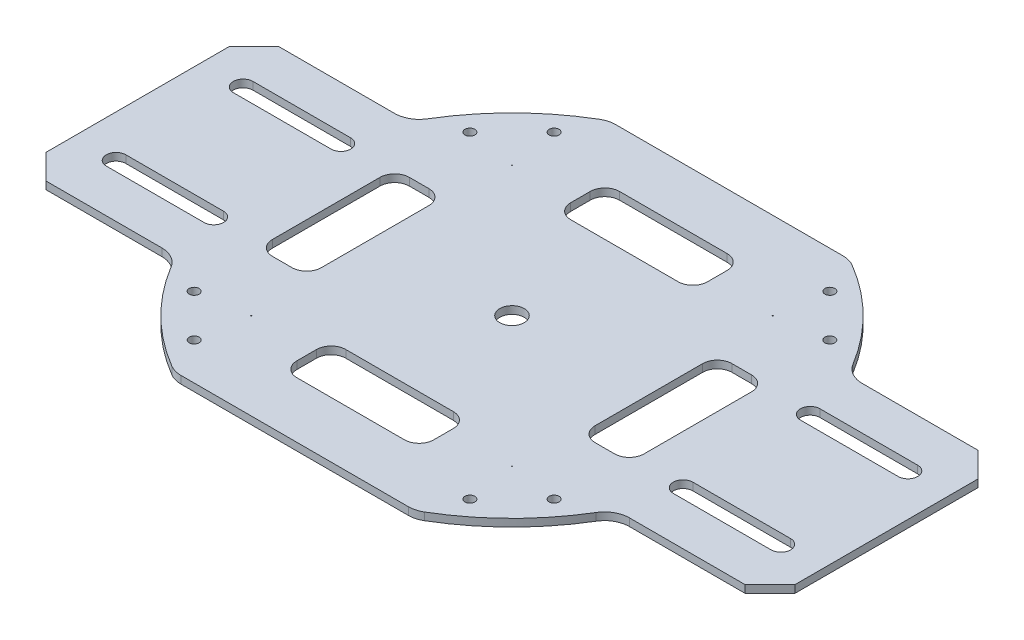
from build123d import *

# Parameters (mm, degrees)
SKETCH1_R           = 2.5
SKETCH1_R_2         = 1.016
SKETCH1_R_3         = 0.080960088
BOSS_EXTRUDE1_DEPTH = 1.55
CUT_EXTRUDE1_DEPTH  = 89.573620564
CUT_EXTRUDE2_DEPTH  = 89.573620564


with BuildPart() as part:
    # Sketch1 → Boss-Extrude1 (new body)
    with BuildSketch(Plane(origin=(0, 0, 0), x_dir=(1, 0, 0), z_dir=(0, 1, 0))):
        with BuildLine():
            Line((-23.244816627, 44.45), (23.244816627, 44.45))
            ThreePointArc((23.244816627, 44.45), (24.583514169, 44.270437622), (25.827574029, 43.744444444))
            ThreePointArc((25.827574029, 43.744444444), (35.740062311, 36.101079569), (43.482663438, 26.265909091))
            ThreePointArc((43.482663438, 26.265909091), (45.334600658, 24.468164919), (47.830929781, 23.8125))
            Line((47.830929781, 23.8125), (71.516875, 23.8125))
            Line((71.516875, 23.8125), (76.596875, 18.7325))
            Line((76.596875, 18.7325), (76.596875, -18.7325))
            Line((76.596875, -18.7325), (71.516875, -23.8125))
            Line((71.516875, -23.8125), (47.830929781, -23.8125))
            ThreePointArc((47.830929781, -23.8125), (45.334600658, -24.468164919), (43.482663438, -26.265909091))
            ThreePointArc((43.482663438, -26.265909091), (35.740062311, -36.101079569), (25.827574029, -43.744444444))
            ThreePointArc((25.827574029, -43.744444444), (24.583514169, -44.270437622), (23.244816627, -44.45))
            Line((23.244816627, -44.45), (-23.244816627, -44.45))
            ThreePointArc((-23.244816627, -44.45), (-24.583514169, -44.270437622), (-25.827574029, -43.744444444))
            ThreePointArc((-25.827574029, -43.744444444), (-35.740062311, -36.101079569), (-43.482663438, -26.265909091))
            ThreePointArc((-43.482663438, -26.265909091), (-45.334600658, -24.468164919), (-47.830929781, -23.8125))
            Line((-47.830929781, -23.8125), (-71.516875, -23.8125))
            Line((-71.516875, -23.8125), (-76.596875, -18.7325))
            Line((-76.596875, -18.7325), (-76.596875, 18.7325))
            Line((-76.596875, 18.7325), (-71.516875, 23.8125))
            Line((-71.516875, 23.8125), (-47.830929781, 23.8125))
            ThreePointArc((-47.830929781, 23.8125), (-45.334600658, 24.468164919), (-43.482663438, 26.265909091))
            ThreePointArc((-43.482663438, 26.265909091), (-35.740062311, 36.101079569), (-25.827574029, 43.744444444))
            ThreePointArc((-25.827574029, 43.744444444), (-24.583514169, 44.270437622), (-23.244816627, 44.45))
        make_face()
        Circle(SKETCH1_R, mode=Mode.SUBTRACT)
        with Locations((36.819050096, 28.19800422)):
            Circle(SKETCH1_R_2, mode=Mode.SUBTRACT)
        with Locations((28.19800422, 36.819050096)):
            Circle(SKETCH1_R_2, mode=Mode.SUBTRACT)
        with Locations((26.671582547, 26.671582547)):
            Circle(SKETCH1_R_3, mode=Mode.SUBTRACT)
        with Locations((26.671582547, -26.671582547)):
            Circle(SKETCH1_R_3, mode=Mode.SUBTRACT)
        with Locations((36.819050096, -28.19800422)):
            Circle(SKETCH1_R_2, mode=Mode.SUBTRACT)
        with Locations((28.19800422, -36.819050096)):
            Circle(SKETCH1_R_2, mode=Mode.SUBTRACT)
        with Locations((-26.671582547, -26.671582547)):
            Circle(SKETCH1_R_3, mode=Mode.SUBTRACT)
        with Locations((-28.19800422, -36.819050096)):
            Circle(SKETCH1_R_2, mode=Mode.SUBTRACT)
        with Locations((-36.819050096, -28.19800422)):
            Circle(SKETCH1_R_2, mode=Mode.SUBTRACT)
        with Locations((-26.671582547, 26.671582547)):
            Circle(SKETCH1_R_3, mode=Mode.SUBTRACT)
        with Locations((-36.819050096, 28.19800422)):
            Circle(SKETCH1_R_2, mode=Mode.SUBTRACT)
        with Locations((-28.19800422, 36.819050096)):
            Circle(SKETCH1_R_2, mode=Mode.SUBTRACT)
    extrude(amount=BOSS_EXTRUDE1_DEPTH)

    # Sketch2 → Cut-Extrude1 (cut, through all)
    with BuildSketch(Plane(origin=(0, 1.55, 0), x_dir=(1, 0, 0), z_dir=(0, 1, 0))):
        with BuildLine():
            Line((48, 15), (68, 15))
            ThreePointArc((68, 15), (70, 13), (68, 11))
            Line((68, 11), (48, 11))
            ThreePointArc((48, 11), (46, 13), (48, 15))
        make_face()
        with BuildLine():
            Line((48, -15), (68, -15))
            ThreePointArc((68, -15), (70, -13), (68, -11))
            Line((68, -11), (48, -11))
            ThreePointArc((48, -11), (46, -13), (48, -15))
        make_face()
        with BuildLine():
            Line((-48, 15), (-68, 15))
            ThreePointArc((-68, 15), (-70, 13), (-68, 11))
            Line((-68, 11), (-48, 11))
            ThreePointArc((-48, 11), (-46, 13), (-48, 15))
        make_face()
        with BuildLine():
            Line((-48, -15), (-68, -15))
            ThreePointArc((-68, -15), (-70, -13), (-68, -11))
            Line((-68, -11), (-48, -11))
            ThreePointArc((-48, -11), (-46, -13), (-48, -15))
        make_face()
    extrude(amount=-CUT_EXTRUDE1_DEPTH, mode=Mode.SUBTRACT)

    # Sketch3 → Cut-Extrude2 (cut, through all)
    with BuildSketch(Plane(origin=(0, 1.55, 0), x_dir=(1, 0, 0), z_dir=(0, 1, 0))):
        with BuildLine():
            Line((-11, 33), (11, 33))
            ThreePointArc((11, 33), (13.121320344, 32.121320344), (14, 30))
            Line((14, 30), (14, 26))
            ThreePointArc((14, 26), (13.121320344, 23.878679656), (11, 23))
            Line((11, 23), (-11, 23))
            ThreePointArc((-11, 23), (-13.121320344, 23.878679656), (-14, 26))
            Line((-14, 26), (-14, 30))
            ThreePointArc((-14, 30), (-13.121320344, 32.121320344), (-11, 33))
        make_face()
        with BuildLine():
            Line((14, -30), (14, -26))
            ThreePointArc((14, -26), (13.121320344, -23.878679656), (11, -23))
            Line((11, -23), (-11, -23))
            ThreePointArc((-11, -23), (-13.121320344, -23.878679656), (-14, -26))
            Line((-14, -26), (-14, -30))
            ThreePointArc((-14, -30), (-13.121320344, -32.121320344), (-11, -33))
            Line((-11, -33), (11, -33))
            ThreePointArc((11, -33), (13.121320344, -32.121320344), (14, -30))
        make_face()
        with BuildLine():
            Line((31, 14), (35, 14))
            ThreePointArc((35, 14), (37.121320344, 13.121320344), (38, 11))
            Line((38, 11), (38, -11))
            ThreePointArc((38, -11), (37.121320344, -13.121320344), (35, -14))
            Line((35, -14), (31, -14))
            ThreePointArc((31, -14), (28.878679656, -13.121320344), (28, -11))
            Line((28, -11), (28, 11))
            ThreePointArc((28, 11), (28.878679656, 13.121320344), (31, 14))
        make_face()
        with BuildLine():
            Line((-38, 11), (-38, -11))
            ThreePointArc((-38, -11), (-37.121320344, -13.121320344), (-35, -14))
            Line((-35, -14), (-31, -14))
            ThreePointArc((-31, -14), (-28.878679656, -13.121320344), (-28, -11))
            Line((-28, -11), (-28, 11))
            ThreePointArc((-28, 11), (-28.878679656, 13.121320344), (-31, 14))
            Line((-31, 14), (-35, 14))
            ThreePointArc((-35, 14), (-37.121320344, 13.121320344), (-38, 11))
        make_face()
    extrude(amount=-CUT_EXTRUDE2_DEPTH, mode=Mode.SUBTRACT)


solid = part.part
